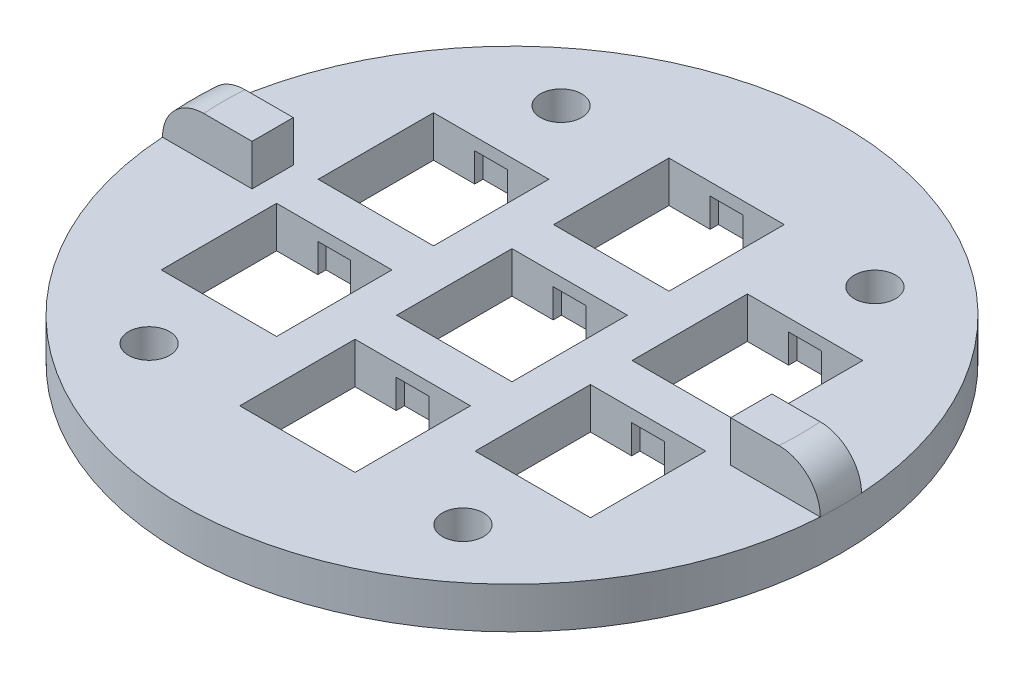
from build123d import *
from OCP.BRepAlgoAPI import BRepAlgoAPI_Cut
from OCP.TopTools import TopTools_ListOfShape

# Parameters (mm, degrees)
SKETCH1_R           = 40
SKETCH1_R_2         = 2.5
SKETCH1_W           = 14
SKETCH1_H           = 14
BOSS_EXTRUDE1_DEPTH = 5
BOSS_EXTRUDE2_DEPTH = 5
FILLET1_R           = 5
SKETCH3_W           = 4
SKETCH3_H           = 1
CUT_EXTRUDE1_DEPTH  = 3.5


with BuildPart() as part:
    # Sketch1 → Boss-Extrude1 (new body)
    with BuildSketch(Plane(origin=(0, 0, 0), x_dir=(1, 0, 0), z_dir=(0, 1, 0))):
        with Locations(Location((0, 0, 0), (0, 0, 270))):
            Circle(SKETCH1_R)
        with Locations(Location((-19.05, 25, 0), (0, 0, 270))):
            Circle(SKETCH1_R_2, mode=Mode.SUBTRACT)
        with Locations(Location((19.05, 25, 0), (0, 0, 270))):
            Circle(SKETCH1_R_2, mode=Mode.SUBTRACT)
        with Locations(Location((19.05, -25, 0), (0, 0, 270))):
            Circle(SKETCH1_R_2, mode=Mode.SUBTRACT)
        with Locations(Location((-19.05, -25, 0), (0, 0, 270))):
            Circle(SKETCH1_R_2, mode=Mode.SUBTRACT)
        with Locations((0, 19.05)):
            Rectangle(SKETCH1_W, SKETCH1_H, mode=Mode.SUBTRACT)
        Rectangle(SKETCH1_W, SKETCH1_H, mode=Mode.SUBTRACT)
        with Locations((0, -19.05)):
            Rectangle(SKETCH1_W, SKETCH1_H, mode=Mode.SUBTRACT)
        with Locations((-19.05, 9.525)):
            Rectangle(SKETCH1_W, SKETCH1_H, mode=Mode.SUBTRACT)
        with Locations((19.05, 9.525)):
            Rectangle(SKETCH1_W, SKETCH1_H, mode=Mode.SUBTRACT)
        with Locations((-19.04999963, -9.524995038)):
            Rectangle(SKETCH1_W, SKETCH1_H, mode=Mode.SUBTRACT)
        with Locations((19.05000037, -9.524995038)):
            Rectangle(SKETCH1_W, SKETCH1_H, mode=Mode.SUBTRACT)
    extrude(amount=BOSS_EXTRUDE1_DEPTH)

    # Sketch2 → Boss-Extrude2 (add)
    with BuildSketch(Plane(origin=(0, 5, 0), x_dir=(1, 0, 0), z_dir=(0, 1, 0))):
        with BuildLine():
            Line((-39.921798557, 2.5), (-29.05, 2.5))
            Line((-29.05, 2.5), (-29.05, -2.5))
            Line((-29.05, -2.5), (-39.921798557, -2.5))
            ThreePointArc((-39.921798557, -2.5), (-40, 0), (-39.921798557, 2.5))
        make_face()
        with BuildLine():
            Line((29.05, 2.5), (29.05, -2.5))
            Line((29.05, -2.5), (39.921798557, -2.5))
            ThreePointArc((39.921798557, -2.5), (40, 0), (39.921798557, 2.5))
            Line((39.921798557, 2.5), (29.05, 2.5))
        make_face()
    extrude(amount=BOSS_EXTRUDE2_DEPTH)

    # Fillet1
    fillet1_edges = [part.edges().sort_by_distance(p)[0] for p in [
        (40, 10, 0),
        (-40, 10, 0),
    ]]
    fillet(fillet1_edges, radius=FILLET1_R - 0.0001)  # a hair under: the kernel refuses the full size


with BuildPart() as cut_extrude1_tool:
    # Sketch3 → Cut-Extrude1 (new body)
    with BuildSketch(Plane.XZ):
        with Locations((0, 26.55)):
            Rectangle(SKETCH3_W, SKETCH3_H)
        with Locations((0, 11.55)):
            Rectangle(SKETCH3_W, SKETCH3_H)
        with Locations((0, 7.5)):
            Rectangle(SKETCH3_W, SKETCH3_H)
        with Locations((0, -7.5)):
            Rectangle(SKETCH3_W, SKETCH3_H)
        with Locations((0, -11.55)):
            Rectangle(SKETCH3_W, SKETCH3_H)
        with Locations((0, -26.55)):
            Rectangle(SKETCH3_W, SKETCH3_H)
        with Locations((-19.04999963, 17.024995038)):
            Rectangle(SKETCH3_W, SKETCH3_H)
        with Locations((-19.04999963, 2.024995038)):
            Rectangle(SKETCH3_W, SKETCH3_H)
        with Locations((19.05000037, 2.024995038)):
            Rectangle(SKETCH3_W, SKETCH3_H)
        with Locations((19.05000037, 17.024995038)):
            Rectangle(SKETCH3_W, SKETCH3_H)
        with Locations((19.05000037, -17.025004962)):
            Rectangle(SKETCH3_W, SKETCH3_H)
        with Locations((19.05000037, -2.025004962)):
            Rectangle(SKETCH3_W, SKETCH3_H)
        with Locations((-19.04999963, -17.025004962)):
            Rectangle(SKETCH3_W, SKETCH3_H)
        with Locations((-19.04999963, -2.025004962)):
            Rectangle(SKETCH3_W, SKETCH3_H)
    extrude(amount=-CUT_EXTRUDE1_DEPTH)


with BuildPart() as part_1:
    add(part.part)

    # Cut-Extrude1: cut by cut_extrude1_tool, with a tolerance
    cut_extrude1_stock = TopTools_ListOfShape()
    cut_extrude1_stock.Append(part_1.part.wrapped)
    cut_extrude1_tools = TopTools_ListOfShape()
    cut_extrude1_tools.Append(cut_extrude1_tool.part.wrapped)
    cut_extrude1_cut = BRepAlgoAPI_Cut()
    cut_extrude1_cut.SetArguments(cut_extrude1_stock)
    cut_extrude1_cut.SetTools(cut_extrude1_tools)
    cut_extrude1_cut.SetFuzzyValue(0.00001)
    cut_extrude1_cut.Build()
    add(Compound.cast(cut_extrude1_cut.Shape()).solids(), mode=Mode.REPLACE)


solid = part_1.part
